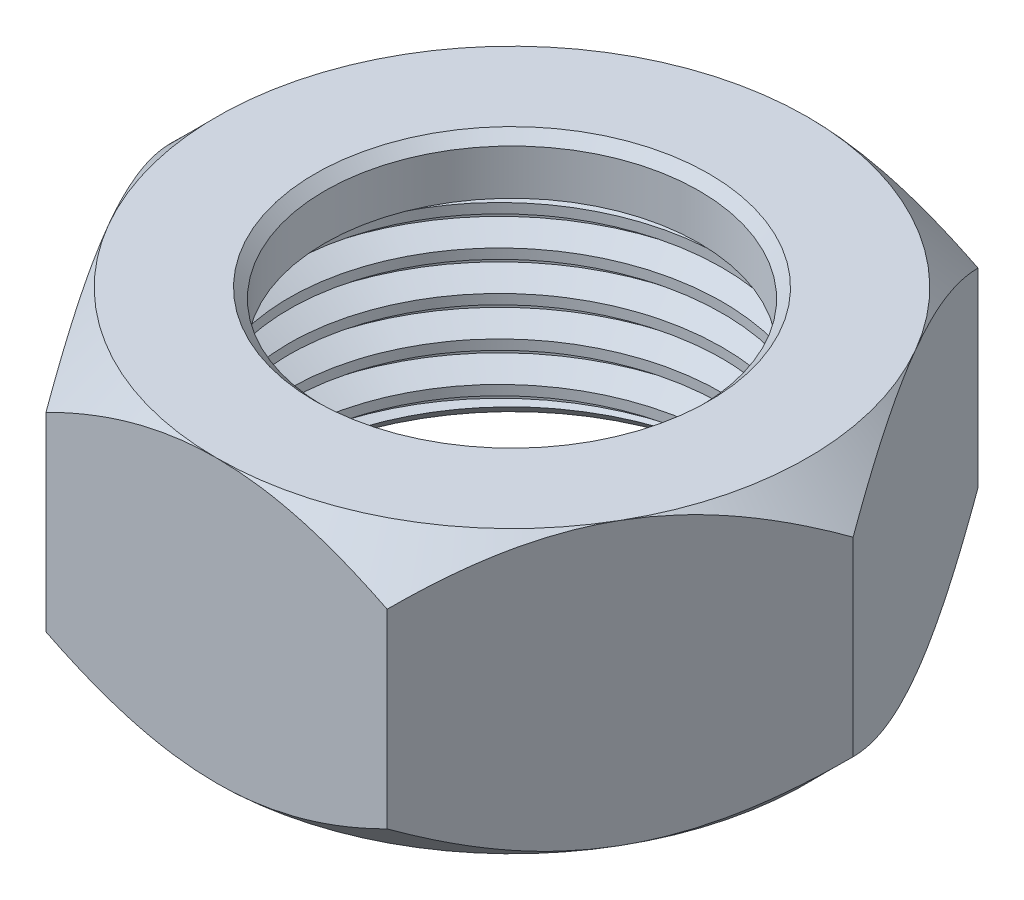
from build123d import *

# Parameters (mm, degrees)
BOSS_EXTRUDE1_DEPTH = 14.3
SKETCH2_R           = 9.5
CUT_EXTRUDE1_DEPTH  = 14.3
SKETCH6_R           = 11
CUT_EXTRUDE2_DEPTH  = 11.5
SKETCH7_OUTSIDE_W   = 69.244
SKETCH7_OUTSIDE_H   = 64.602
SKETCH7_OUTSIDE_R   = 15.000006818
CUT_EXTRUDE3_DEPTH  = 11.5
CUT_EXTRUDE3_DRAFT  = -45
SKETCH8_OUTSIDE_W   = 69.244
SKETCH8_OUTSIDE_H   = 64.602
SKETCH8_OUTSIDE_R   = 15.000006818
CUT_EXTRUDE4_DEPTH  = 11.5
CUT_EXTRUDE4_DRAFT  = -45
CHAMFER1_SIZE       = 1.5
CHAMFER2_SIZE       = 0.5
THREAD1_PITCH       = 2


with BuildPart() as part:
    # Sketch1 → Boss-Extrude1 (new body)
    with BuildSketch(Plane(origin=(0, 0, 0), x_dir=(1, 0, 0), z_dir=(0, 1, 0))):
        Polygon((17.320508076, 0), (8.660254038, 15), (-8.660254038, 15), (-17.320508076, 0), (-8.660254038, -15), (8.660254038, -15), align=None)
    extrude(amount=BOSS_EXTRUDE1_DEPTH)

    # Sketch2 → Cut-Extrude1 (cut)
    with BuildSketch(Plane(origin=(0, 14.3, 0), x_dir=(1, 0, 0), z_dir=(0, 1, 0))):
        with Locations(Location((0, 0, 0), (0, 0, 270))):
            Circle(SKETCH2_R)
    extrude(amount=-CUT_EXTRUDE1_DEPTH, mode=Mode.SUBTRACT)

    # Sketch6 → Cut-Extrude2 (cut)
    with BuildSketch(Plane.XZ):
        with Locations(Location((0, 0, 0), (0, 0, 270))):
            Circle(SKETCH6_R)
    extrude(amount=-CUT_EXTRUDE2_DEPTH, mode=Mode.SUBTRACT)


with BuildPart() as cut_extrude3_tool:
    # Sketch7 outside → Cut-Extrude3 (with draft: the straight prism first)
    with BuildSketch(Plane(origin=(0, 14.3, 0), x_dir=(1, 0, 0), z_dir=(0, 1, 0))):
        Rectangle(SKETCH7_OUTSIDE_W, SKETCH7_OUTSIDE_H)
        Circle(SKETCH7_OUTSIDE_R, mode=Mode.SUBTRACT)
    extrude(amount=-CUT_EXTRUDE3_DEPTH)
    # Cut-Extrude3: the draft: its side faces are tilted about the plane it starts from
    cut_extrude3_sides = [cut_extrude3_tool.faces().sort_by_distance(p)[0] for p in [
        (0, 8.55, 32.301),
        (34.622, 8.55, 0),
        (0, 8.55, -32.301),
        (-34.622, 8.55, 0),
        (-15.000006818, 8.55, 0),
    ]]
    draft(cut_extrude3_sides, Plane(origin=(0, 14.3, 0), x_dir=(1, 0, 0), z_dir=(0, 1, 0)), CUT_EXTRUDE3_DRAFT)


with BuildPart() as part_1:
    add(part.part)

    # Cut-Extrude3: cut by cut_extrude3_tool
    add(cut_extrude3_tool.part, mode=Mode.SUBTRACT)


with BuildPart() as cut_extrude4_tool:
    # Sketch8 outside → Cut-Extrude4 (with draft: the straight prism first)
    with BuildSketch(Plane.XZ):
        Rectangle(SKETCH8_OUTSIDE_W, SKETCH8_OUTSIDE_H)
        Circle(SKETCH8_OUTSIDE_R, mode=Mode.SUBTRACT)
    extrude(amount=-CUT_EXTRUDE4_DEPTH)
    # Cut-Extrude4: the draft: its side faces are tilted about the plane it starts from
    cut_extrude4_sides = [cut_extrude4_tool.faces().sort_by_distance(p)[0] for p in [
        (0, 5.75, -32.301),
        (34.622, 5.75, 0),
        (0, 5.75, 32.301),
        (-34.622, 5.75, 0),
        (-15.000006818, 5.75, 0),
    ]]
    draft(cut_extrude4_sides, Plane.XZ, CUT_EXTRUDE4_DRAFT)


with BuildPart() as part_2:
    add(part_1.part)

    # Cut-Extrude4: cut by cut_extrude4_tool
    add(cut_extrude4_tool.part, mode=Mode.SUBTRACT)

    # Chamfer1
    chamfer1_edges = [part_2.edges().sort_by_distance(p)[0] for p in [
        (0, 0, 11),
    ]]
    chamfer(chamfer1_edges, length=CHAMFER1_SIZE)

    # Chamfer2
    chamfer2_edges = [part_2.edges().sort_by_distance(p)[0] for p in [
        (0, 14.3, -9.5),
    ]]
    chamfer(chamfer2_edges, length=CHAMFER2_SIZE)

    # Thread1: the profile of Thread Profile1 profile screwed along a right-hand helix of 7 turns, 10 arcs to a turn; built about Z, then put on its axis
    thread1_z = Axis((0, 0, 0), (0, 0, 1))
    thread1_corners = [(10.9997, 0, -0.000173205), (12.08253175, 0, 0.624999997), (12.08253175, 0, 0.874999997), (10.9997, 0, 1.5001732)]
    with BuildLine(mode=Mode.PRIVATE) as thread1_profile:
        Line(thread1_corners[0], thread1_corners[1])
        Line(thread1_corners[1], thread1_corners[2])
        Line(thread1_corners[2], thread1_corners[3])
        Line(thread1_corners[3], thread1_corners[0])
    thread1_cap = Face(thread1_profile.wire())
    thread1_turn_angles = [0, 18, 36, 54, 72, 90, 108, 126, 144, 162, 180, 198, 216, 234, 252, 270, 288, 306, 324, 342, 360]
    thread1_turn_weights = [1, 0.9510565162951535, 1, 0.9510565162951535, 1, 0.9510565162951535, 1, 0.9510565162951535, 1, 0.9510565162951535, 1, 0.9510565162951535, 1, 0.9510565162951535, 1, 0.9510565162951535, 1, 0.9510565162951535, 1, 0.9510565162951535, 1]
    thread1_turn_rails = [Edge.make_bspline([Vector(p[0], p[1], 0).rotate(thread1_z, thread1_turn_angles[k]) / thread1_turn_weights[k] + Vector(0, 0, p[2] + THREAD1_PITCH * thread1_turn_angles[k] / 360) for k in range(21)], [0, 0, 0, 1, 1, 2, 2, 3, 3, 4, 4, 5, 5, 6, 6, 7, 7, 8, 8, 9, 9, 10, 10, 10], 2, thread1_turn_weights) for p in thread1_corners]
    thread1_turn_sides = [Face.make_surface_from_curves(thread1_turn_rails[p[0]], thread1_turn_rails[p[1]]) for p in [(0, 1), (1, 2), (2, 3), (3, 0)]]
    thread1 = Plane(origin=(0, -2.5, 0), x_dir=(1, 0, 0), z_dir=(0, 1, 0)) * Solid(Shell([*[p.moved(Location((0, 0, THREAD1_PITCH * i))) for i in range(7) for p in thread1_turn_sides], thread1_cap, thread1_cap.rotate(thread1_z, 2520).moved(Location((0, 0, THREAD1_PITCH * 2520 / 360)))]))
    add(thread1, mode=Mode.SUBTRACT)


solid = part_2.part
